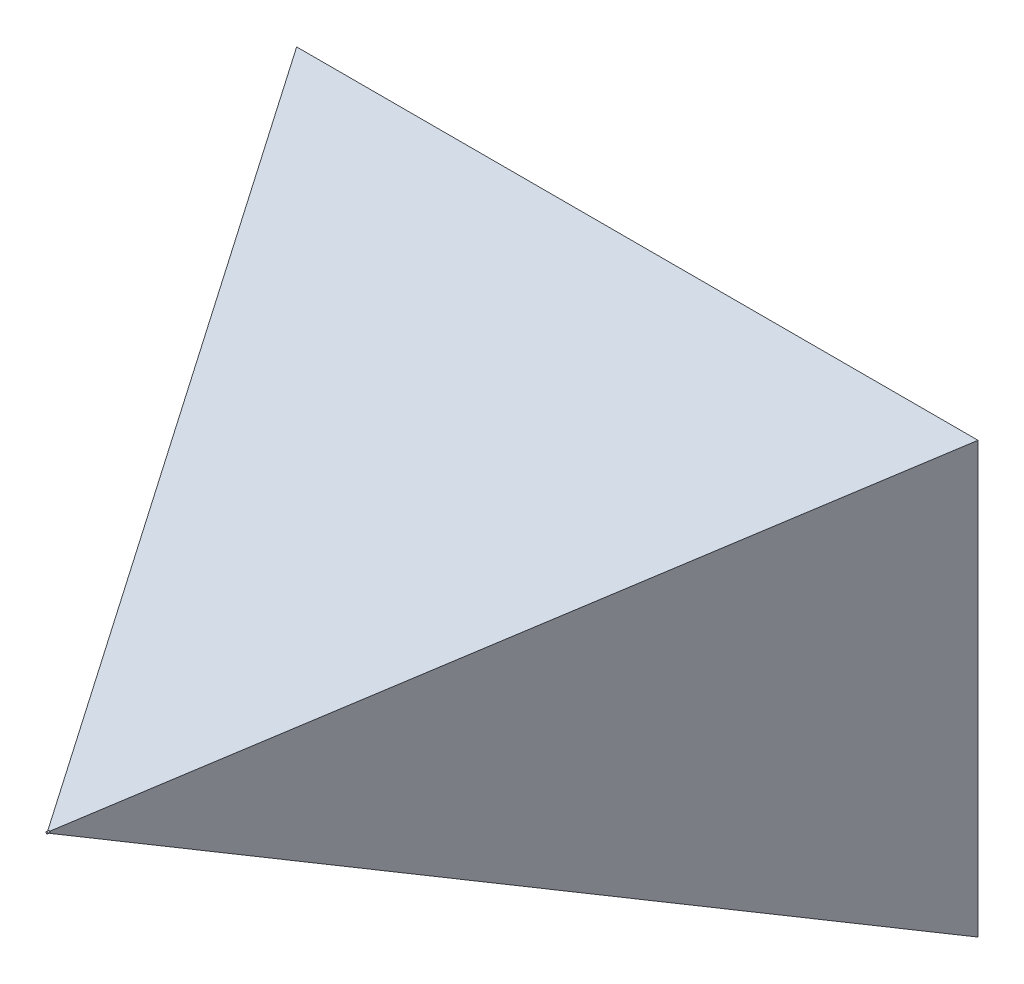
from build123d import *

# Parameters (mm, degrees)
SKETCH1_W           = 800
SKETCH1_H           = 800
BOSS_EXTRUDE1_DEPTH = 600
CUT_EXTRUDE1_DEPTH  = 1281.624847487
CUT_EXTRUDE2_DEPTH  = 1177.279828971
SKETCH4_R           = 1
BOSS_EXTRUDE2_DEPTH = 2


with BuildPart() as part:
    # Sketch1 → Boss-Extrude1 (new body)
    with BuildSketch(Plane.XY):
        with Locations((400, 400)):
            Rectangle(SKETCH1_W, SKETCH1_H)
    extrude(amount=BOSS_EXTRUDE1_DEPTH)

    # Sketch2 → Cut-Extrude1 (cut, through all)
    with BuildSketch(Plane(origin=(800, 0, 0), x_dir=(0, 0, -1), z_dir=(1, 0, 0))):
        Polygon((-600, 800), (-600, 401), (496.243490362, 800), align=None)
        Polygon((496.243490362, 0), (-600, 0), (-600, 399), align=None)
    extrude(amount=-CUT_EXTRUDE1_DEPTH, mode=Mode.SUBTRACT)

    # Sketch3 → Cut-Extrude2 (cut, through all)
    with BuildSketch(Plane.XZ):
        Polygon((401, 600), (800, -91.08827222), (800, 600), align=None)
        Polygon((0, 600), (0, -91.08827222), (399, 600), align=None)
    extrude(amount=-CUT_EXTRUDE2_DEPTH, mode=Mode.SUBTRACT)

    # Sketch4 → Boss-Extrude2 (add)
    with BuildSketch(Plane.XY.offset(600)):
        with Locations((400, 400)):
            Circle(SKETCH4_R)
    extrude(amount=BOSS_EXTRUDE2_DEPTH)


solid = part.part
